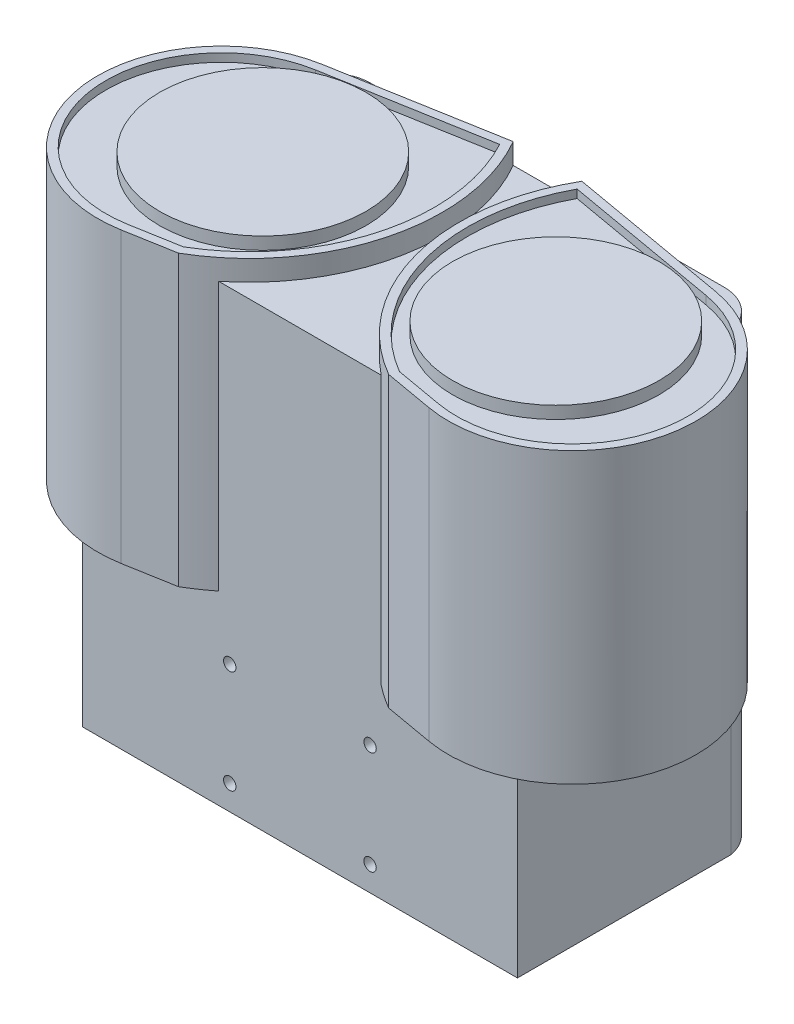
from build123d import *
from build123d.topology import SkipClean

# Parameters (mm, degrees)
SALIENTE_EXTRUIR1_DEPTH        = 60
SALIENTE_EXTRUIR1_DEPTH_BACK   = 10
SALIENTE_EXTRUIR1_2_DEPTH      = 60
SALIENTE_EXTRUIR1_2_DEPTH_BACK = 10
CROQUIS5_W                     = 105.42
CROQUIS5_H                     = 65
SALIENTE_EXTRUIR4_DEPTH        = 60
REDONDEO1_R                    = 10
CORTAR_EXTRUIR3_DEPTH          = 2
CROQUIS8_R                     = 25
SALIENTE_EXTRUIR5_DEPTH        = 3
SALIENTE_EXTRUIR6_DEPTH        = 45
CROQUIS10_R                    = 1.5
CORTAR_EXTRUIR4_DEPTH          = 5
CROQUIS11_R                    = 1.5
CORTAR_EXTRUIR5_DEPTH          = 5


with BuildPart() as part:
    # Croquis1 → Saliente-Extruir1 (new, two sides: drawn at the far end of the back side and taken through both)
    with BuildSketch(Plane(origin=(0, 0, 0), x_dir=(1, 0, 0), z_dir=(0, 1, 0)).offset(-SALIENTE_EXTRUIR1_DEPTH_BACK)):
        with BuildLine():
            Line((-5.20944533, 29.54423259), (34.18286479, 36.490159697))
            ThreePointArc((34.18286479, 36.490159697), (38.849607431, 0.961785341), (17.027138366, -27.460454458))
            Line((17.027138366, -27.460454458), (5.20944533, -29.54423259))
            ThreePointArc((5.20944533, -29.54423259), (-29.54423259, -5.20944533), (-5.20944533, 29.54423259))
        make_face()
    extrude(amount=SALIENTE_EXTRUIR1_DEPTH + SALIENTE_EXTRUIR1_DEPTH_BACK)



with BuildPart() as body_2:
    # Croquis1 → Saliente-Extruir1 2 (new, two sides: drawn at the far end of the back side and taken through both)
    with BuildSketch(Plane(origin=(0, 0, 0), x_dir=(1, 0, 0), z_dir=(0, 1, 0)).offset(-SALIENTE_EXTRUIR1_2_DEPTH_BACK)):
        with BuildLine():
            Line((90.20944533, 29.54423259), (50.81713521, 36.490159697))
            ThreePointArc((50.81713521, 36.490159697), (46.150392569, 0.961785341), (67.972861634, -27.460454458))
            Line((67.972861634, -27.460454458), (79.79055467, -29.54423259))
            ThreePointArc((79.79055467, -29.54423259), (114.54423259, -5.20944533), (90.20944533, 29.54423259))
        make_face()
    extrude(amount=SALIENTE_EXTRUIR1_2_DEPTH + SALIENTE_EXTRUIR1_2_DEPTH_BACK)


with BuildPart() as part_1:
    add(part.part)

    add(body_2.part)  # Saliente-Extruir4 merges body 2
    # Croquis5 → Saliente-Extruir4 (add)
    with BuildSketch(Plane(origin=(0, 0, -36.490159697), x_dir=(-1, 0, 0), z_dir=(0, 0, -1))):
        with Locations((-42.50055467, 22.5)):
            Rectangle(CROQUIS5_W, CROQUIS5_H)
    extrude(amount=-SALIENTE_EXTRUIR4_DEPTH)

    # Redondeo1
    # the kernel refuses this fillet: 10 mm, written as the material it takes off along each edge
    with BuildSketch(Plane(origin=(-10.20944533, 79.627778647, -36.490159697), x_dir=(1, 0, 0), z_dir=(0, -1, 0))) as redondeo1_piece_1:
        with BuildLine():
            CenterArc((9.851111459, 10), REDONDEO1_R, 189.899393553, 80.100606447)
            Line((0, 8.280813266), (-0.197022229, 8.246429532))
            ThreePointArc((-0.197022229, 8.246429532), (-0.2, 4.140406633), (-0.2, 0))
            Line((-0.2, 0), (0, -0.2))
            Line((0, -0.2), (9.851111459, -0.2))
            Line((9.851111459, -0.2), (9.851111459, 0))
        make_face()
    extrude(amount=114.255557294, mode=Mode.SUBTRACT)
    with BuildSketch(Plane(origin=(95.21055467, -34.627953804, -36.490159697), x_dir=(-1, 0, 0), z_dir=(0, 1, 0))) as redondeo1_piece_2:
        with BuildLine():
            CenterArc((9.851181521, 10), REDONDEO1_R, 189.897058287, 80.102941713)
            Line((0, 8.28121478), (-0.19702363, 8.246839076))
            ThreePointArc((-0.19702363, 8.246839076), (-0.2, 4.14060739), (-0.2, 0))
            Line((-0.2, 0), (0, -0.2))
            Line((0, -0.2), (9.851181521, -0.2))
            Line((9.851181521, -0.2), (9.851181521, 0))
        make_face()
    extrude(amount=114.255907607, mode=Mode.SUBTRACT)

    # Croquis7 → Cortar-Extruir3 (cut)
    with BuildSketch(Plane(origin=(0, 60, 0), x_dir=(1, 0, 0), z_dir=(0, 1, 0))):
        with BuildLine():
            Line((4.862148975, -27.574617084), (16.328937751, -25.552712841))
            ThreePointArc((16.328937751, -25.552712841), (36.779644877, 0.976339149), (33.127899287, 34.273287591))
            Line((33.127899287, 34.273287591), (-4.862148975, 27.574617084))
            ThreePointArc((-4.862148975, 27.574617084), (-27.574617084, -4.862148975), (4.862148975, -27.574617084))
        make_face()
        with BuildLine():
            Line((89.862148975, 27.574617084), (51.872100713, 34.273287591))
            ThreePointArc((51.872100713, 34.273287591), (48.220355123, 0.976339149), (68.671062249, -25.552712841))
            Line((68.671062249, -25.552712841), (80.137851025, -27.574617084))
            ThreePointArc((80.137851025, -27.574617084), (112.574617084, -4.862148975), (89.862148975, 27.574617084))
        make_face()
    extrude(amount=-CORTAR_EXTRUIR3_DEPTH, mode=Mode.SUBTRACT)

    # Croquis8 → Saliente-Extruir5 (add)
    with BuildSketch(Plane(origin=(0, 58, 0), x_dir=(1, 0, 0), z_dir=(0, 1, 0))):
        with Locations(Location((7, 3, 0), (0, 0, 270))):
            Circle(CROQUIS8_R)
        with Locations(Location((78, 3, 0), (0, 0, 270))):
            Circle(CROQUIS8_R)
    extrude(amount=SALIENTE_EXTRUIR5_DEPTH)

    # Croquis9 → Saliente-Extruir6 (add)
    with SkipClean():  # the faces are left unmerged after this step: merging them gives an invalid solid
        with BuildSketch(Plane.XZ.offset(10)):
            with BuildLine():
                ThreePointArc((85.359373149, -36.490159697), (91.794128303, -34.144826646), (95.21055467, -28.208944917))
                Line((95.21055467, -28.208944917), (95.21055467, 23.509840303))
                Line((95.21055467, 23.509840303), (62.176934943, 23.509840303))
                Line((62.176934943, 23.509840303), (22.823065057, 23.509840303))
                Line((22.823065057, 23.509840303), (-10.20944533, 23.509840303))
                Line((-10.20944533, 23.509840303), (-10.20944533, -28.209346431))
                ThreePointArc((-10.20944533, -28.209346431), (-6.79293303, -34.144957779), (-0.358333871, -36.490159697))
                Line((-0.358333871, -36.490159697), (85.359373149, -36.490159697))
            make_face()
        extrude(amount=SALIENTE_EXTRUIR6_DEPTH)

    # Croquis10 → Cortar-Extruir4 (cut)
    with SkipClean():  # the faces are left unmerged after this step: merging them gives an invalid solid
        with BuildSketch(Plane.XY.offset(23.509840303)):
            with Locations((59.50055467, -24)):
                Circle(CROQUIS10_R)
            with Locations((59.50055467, -49)):
                Circle(CROQUIS10_R)
            with Locations((25.50055467, -24)):
                Circle(CROQUIS10_R)
            with Locations((25.50055467, -49)):
                Circle(CROQUIS10_R)
        extrude(amount=-CORTAR_EXTRUIR4_DEPTH, mode=Mode.SUBTRACT)

    # Croquis11 → Cortar-Extruir5 (cut)
    with SkipClean():  # the faces are left unmerged after this step: merging them gives an invalid solid
        with BuildSketch(Plane(origin=(0, 0, -36.490159697), x_dir=(-1, 0, 0), z_dir=(0, 0, -1))):
            with Locations((-62.500519639, 40)):
                Circle(CROQUIS11_R)
            with Locations((-22.500519639, 40)):
                Circle(CROQUIS11_R)
            with Locations((-14.500519639, -30)):
                Circle(CROQUIS11_R)
            with Locations((-70.500519639, -30)):
                Circle(CROQUIS11_R)
        extrude(amount=-CORTAR_EXTRUIR5_DEPTH, mode=Mode.SUBTRACT)


solid = part_1.part
